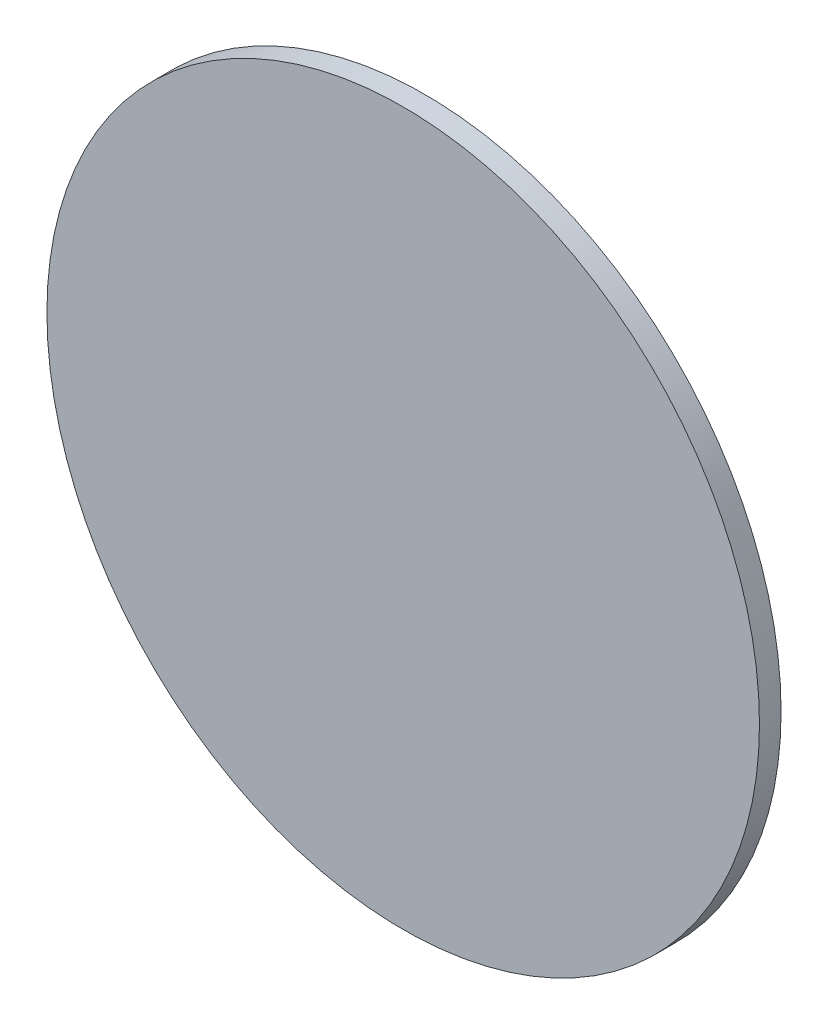
from build123d import *

# Parameters (mm, degrees)
CROQUIS1_R              = 82.42
SALIENTE_EXTRUIR1_DEPTH = 5


with BuildPart() as part:
    # Croquis1 → Saliente-Extruir1 (new body)
    with BuildSketch(Plane.XY):
        Circle(CROQUIS1_R)
    extrude(amount=SALIENTE_EXTRUIR1_DEPTH)


solid = part.part
